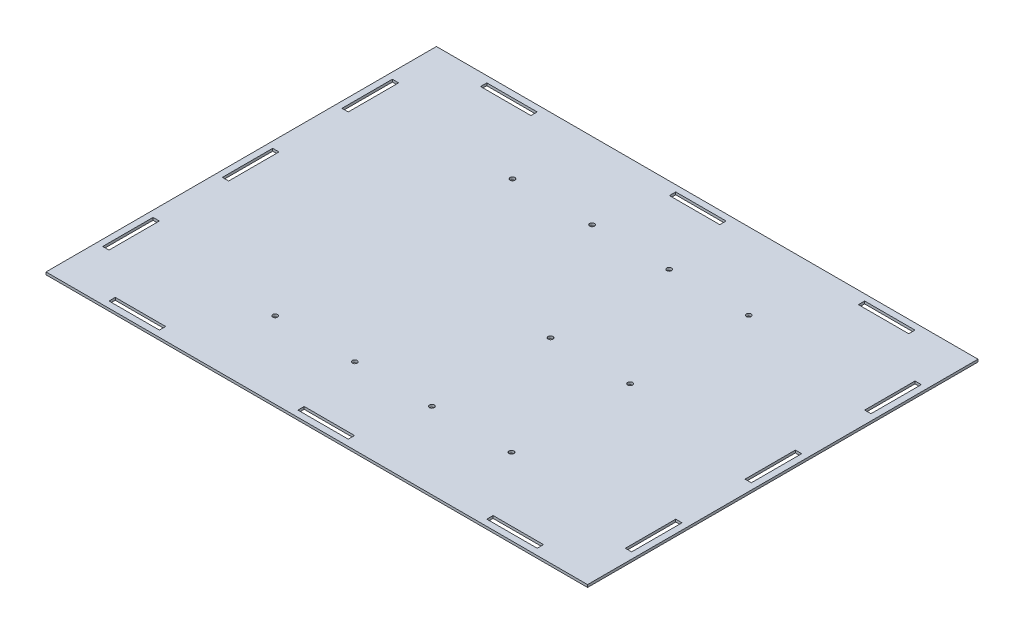
from build123d import *

# Parameters (mm, degrees)
BOSS_EXTRUDE1_DEPTH         = 2.54
F_11_0_191_DIAMETER_HOLE2_D = 4.8514
F_11_0_191_DIAMETER_HOLE3_D = 4.8514
SKETCH17_W                  = 6.35
SKETCH17_H                  = 50.8
SKETCH17_W_2                = 50.8
SKETCH17_H_2                = 6.35
SKETCH17_H_3                = 25.4
CUT_EXTRUDE12_DEPTH         = 304.883162745
MIRROR1_OUTLINE_W           = 6.35
MIRROR1_OUTLINE_H           = 50.8
MIRROR1_OUTLINE_R           = 2.4257
MIRROR1_OUTLINE_W_2         = 50.8
MIRROR1_OUTLINE_H_2         = 6.35
MIRROR1_DEPTH               = 2.54
SHELL1_START                = 0.1016
SHELL1_OUTLINE_W            = 545.8968
SHELL1_OUTLINE_H            = 393.4968
SHELL1_OUTLINE_W_2          = 51.0032
SHELL1_OUTLINE_H_2          = 6.5532
SHELL1_OUTLINE_W_3          = 6.5532
SHELL1_OUTLINE_H_3          = 51.0032
SHELL1_OUTLINE_R            = 2.5273
SHELL1_DEPTH                = 2.3368


# Read off the part's stored shape, not the designer's step: Mirror1, Shell1
with BuildPart() as part:
    # Sketch1 → Boss-Extrude1 (new body)
    with BuildSketch(Plane(origin=(0, 0, 0), x_dir=(1, 0, 0), z_dir=(0, 1, 0))):
        Polygon((0, 63.5), (-273.05, 63.5), (-273.05, -63.5), (-273.05, -133.35), (273.05, -133.35), (273.05, -63.5), (273.05, 63.5), align=None)
    extrude(amount=BOSS_EXTRUDE1_DEPTH)

    # #11 (0.191) Diameter Hole2 (through all)
    with Locations(Plane(origin=(0, 2.54, 0), x_dir=(1, 0, 0), z_dir=(0, 1, 0))):
        with Locations((-119.126, -56.127777467), (-38.862, -56.127777467), (38.862, -56.127777467), (119.126, -56.127777467)):
            Hole(F_11_0_191_DIAMETER_HOLE2_D / 2)

    # #11 (0.191) Diameter Hole3 (through all)
    with Locations(Plane(origin=(0, 2.54, 0), x_dir=(1, 0, 0), z_dir=(0, 1, 0))):
        with Locations((119.126, 63.5), (38.862, 63.5)):
            Hole(F_11_0_191_DIAMETER_HOLE3_D / 2)

    # Sketch17 → Cut-Extrude12 (cut, through all)
    with BuildSketch(Plane(origin=(0, 2.54, 0), x_dir=(1, 0, 0), z_dir=(0, 1, 0))):
        with Locations((-263.525, -57.15)):
            Rectangle(SKETCH17_W, SKETCH17_H)
        with Locations((-190.5, -123.825)):
            Rectangle(SKETCH17_W_2, SKETCH17_H_2)
        with Locations((190.5, -123.825)):
            Rectangle(SKETCH17_W_2, SKETCH17_H_2)
        with Locations((263.525, -57.15)):
            Rectangle(SKETCH17_W, SKETCH17_H)
        with Locations((0, -123.825)):
            Rectangle(SKETCH17_W_2, SKETCH17_H_2)
        with Locations((-263.525, 50.8)):
            Rectangle(SKETCH17_W, SKETCH17_H_3)
        with Locations((263.525, 50.8)):
            Rectangle(SKETCH17_W, SKETCH17_H_3)
    extrude(amount=-CUT_EXTRUDE12_DEPTH, mode=Mode.SUBTRACT)

    # Mirror1 outline → Mirror1 (add)
    with BuildSketch(Plane(origin=(0, 0, 0), x_dir=(1, 0, 0), z_dir=(0, 1, 0))):
        with BuildLine():
            Line((273.05, 63.5), (273.05, 260.35))
            Line((273.05, 260.35), (-273.05, 260.35))
            Line((-273.05, 260.35), (-273.05, 63.5))
            Line((-273.05, 63.5), (-266.7, 63.5))
            Line((-266.7, 63.5), (-266.7, 88.9))
            Line((-266.7, 88.9), (-260.35, 88.9))
            Line((-260.35, 88.9), (-260.35, 63.5))
            Line((-260.35, 63.5), (36.4363, 63.5))
            ThreePointArc((36.4363, 63.5), (38.862, 65.9257), (41.2877, 63.5))
            Line((41.2877, 63.5), (116.7003, 63.5))
            ThreePointArc((116.7003, 63.5), (119.126, 65.9257), (121.5517, 63.5))
            Line((121.5517, 63.5), (260.35, 63.5))
            Line((260.35, 63.5), (260.35, 88.9))
            Line((260.35, 88.9), (266.7, 88.9))
            Line((266.7, 88.9), (266.7, 63.5))
            Line((266.7, 63.5), (273.05, 63.5))
        make_face()
        with Locations((-263.525, 184.15)):
            Rectangle(MIRROR1_OUTLINE_W, MIRROR1_OUTLINE_H, mode=Mode.SUBTRACT)
        with Locations((-119.126, 183.127777467)):
            Circle(MIRROR1_OUTLINE_R, mode=Mode.SUBTRACT)
        with Locations((-38.862, 183.127777467)):
            Circle(MIRROR1_OUTLINE_R, mode=Mode.SUBTRACT)
        with Locations((-190.5, 250.825)):
            Rectangle(MIRROR1_OUTLINE_W_2, MIRROR1_OUTLINE_H_2, mode=Mode.SUBTRACT)
        with Locations((38.862, 183.127777467)):
            Circle(MIRROR1_OUTLINE_R, mode=Mode.SUBTRACT)
        with Locations((119.126, 183.127777467)):
            Circle(MIRROR1_OUTLINE_R, mode=Mode.SUBTRACT)
        with Locations((263.525, 184.15)):
            Rectangle(MIRROR1_OUTLINE_W, MIRROR1_OUTLINE_H, mode=Mode.SUBTRACT)
        with Locations((0, 250.825)):
            Rectangle(MIRROR1_OUTLINE_W_2, MIRROR1_OUTLINE_H_2, mode=Mode.SUBTRACT)
        with Locations((190.5, 250.825)):
            Rectangle(MIRROR1_OUTLINE_W_2, MIRROR1_OUTLINE_H_2, mode=Mode.SUBTRACT)
    extrude(amount=MIRROR1_DEPTH)

    # Shell1 outline → Shell1 (cut)
    with BuildSketch(Plane(origin=(0, 0, 0), x_dir=(1, 0, 0), z_dir=(0, 1, 0)).offset(SHELL1_START)):
        with Locations((0, 63.5)):
            Rectangle(SHELL1_OUTLINE_W, SHELL1_OUTLINE_H)
        with Locations((-190.5, -123.825)):
            Rectangle(SHELL1_OUTLINE_W_2, SHELL1_OUTLINE_H_2, mode=Mode.SUBTRACT)
        with Locations((-263.525, -57.15)):
            Rectangle(SHELL1_OUTLINE_W_3, SHELL1_OUTLINE_H_3, mode=Mode.SUBTRACT)
        with Locations((-119.126, -56.127777467)):
            Circle(SHELL1_OUTLINE_R, mode=Mode.SUBTRACT)
        with Locations((-38.862, -56.127777467)):
            Circle(SHELL1_OUTLINE_R, mode=Mode.SUBTRACT)
        with Locations((0, -123.825)):
            Rectangle(SHELL1_OUTLINE_W_2, SHELL1_OUTLINE_H_2, mode=Mode.SUBTRACT)
        with Locations((38.862, -56.127777467)):
            Circle(SHELL1_OUTLINE_R, mode=Mode.SUBTRACT)
        with Locations((119.126, -56.127777467)):
            Circle(SHELL1_OUTLINE_R, mode=Mode.SUBTRACT)
        with Locations((190.5, -123.825)):
            Rectangle(SHELL1_OUTLINE_W_2, SHELL1_OUTLINE_H_2, mode=Mode.SUBTRACT)
        with Locations((263.525, -57.15)):
            Rectangle(SHELL1_OUTLINE_W_3, SHELL1_OUTLINE_H_3, mode=Mode.SUBTRACT)
        with Locations((-263.525, 63.5)):
            Rectangle(SHELL1_OUTLINE_W_3, SHELL1_OUTLINE_H_3, mode=Mode.SUBTRACT)
        with Locations((-263.525, 184.15)):
            Rectangle(SHELL1_OUTLINE_W_3, SHELL1_OUTLINE_H_3, mode=Mode.SUBTRACT)
        with Locations((-190.5, 250.825)):
            Rectangle(SHELL1_OUTLINE_W_2, SHELL1_OUTLINE_H_2, mode=Mode.SUBTRACT)
        with Locations((-119.126, 183.127777467)):
            Circle(SHELL1_OUTLINE_R, mode=Mode.SUBTRACT)
        with Locations((-38.862, 183.127777467)):
            Circle(SHELL1_OUTLINE_R, mode=Mode.SUBTRACT)
        with Locations((38.862, 63.5)):
            Circle(SHELL1_OUTLINE_R, mode=Mode.SUBTRACT)
        with Locations((119.126, 63.5)):
            Circle(SHELL1_OUTLINE_R, mode=Mode.SUBTRACT)
        with Locations((263.525, 63.5)):
            Rectangle(SHELL1_OUTLINE_W_3, SHELL1_OUTLINE_H_3, mode=Mode.SUBTRACT)
        with Locations((38.862, 183.127777467)):
            Circle(SHELL1_OUTLINE_R, mode=Mode.SUBTRACT)
        with Locations((119.126, 183.127777467)):
            Circle(SHELL1_OUTLINE_R, mode=Mode.SUBTRACT)
        with Locations((0, 250.825)):
            Rectangle(SHELL1_OUTLINE_W_2, SHELL1_OUTLINE_H_2, mode=Mode.SUBTRACT)
        with Locations((263.525, 184.15)):
            Rectangle(SHELL1_OUTLINE_W_3, SHELL1_OUTLINE_H_3, mode=Mode.SUBTRACT)
        with Locations((190.5, 250.825)):
            Rectangle(SHELL1_OUTLINE_W_2, SHELL1_OUTLINE_H_2, mode=Mode.SUBTRACT)
    extrude(amount=SHELL1_DEPTH, mode=Mode.SUBTRACT)


solid = part.part
